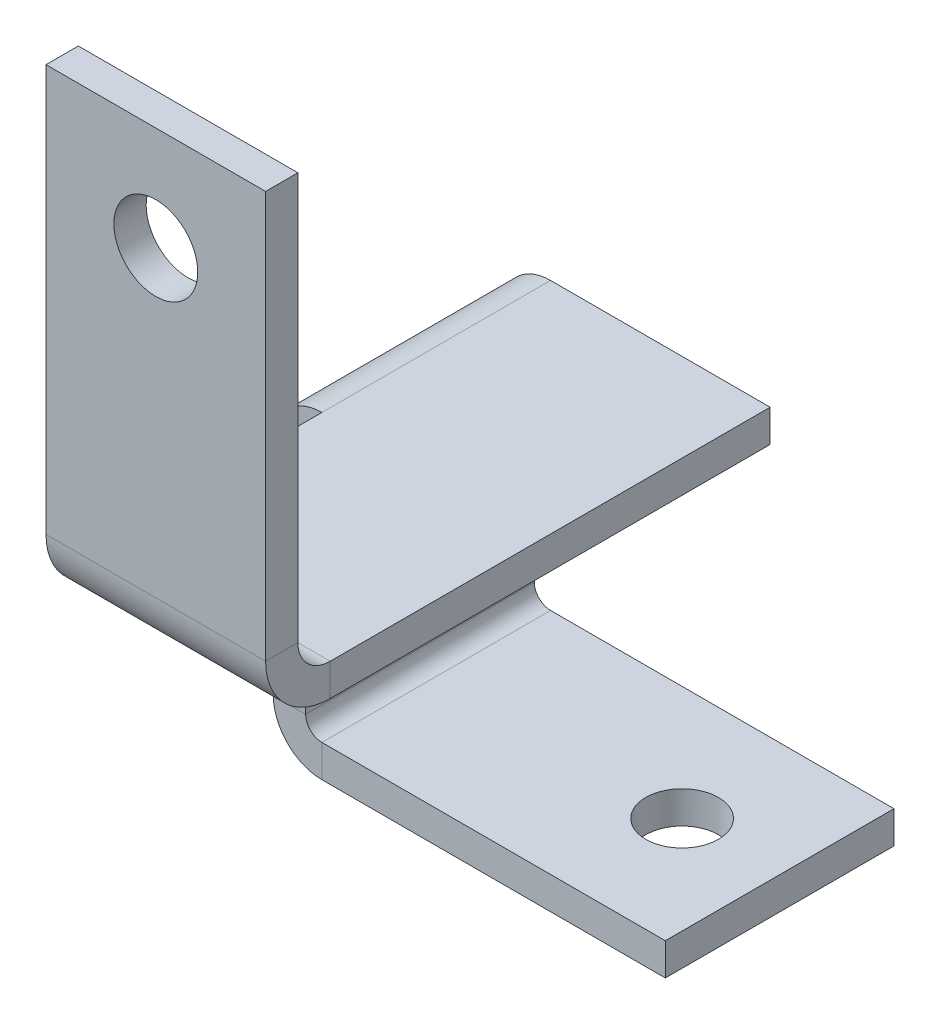
from build123d import *

# Parameters (mm, degrees)
SKETCH1_W                    = 21.59
SKETCH1_H                    = 43.18
SKETCH1_R                    = 4.124999878
BOSS_EXTRUDE1_DEPTH          = 3.175
EDGE_FLANGE1_STRIP_W         = 19.05
EDGE_FLANGE1_STRIP_H         = 3.175
EDGE_FLANGE1_STRIP_CUT_DEPTH = 21.59
EDGE_FLANGE1_DEPTH           = 21.59
EDGE_FLANGE2_DEPTH           = 22.48154
EDGE_FLANGE2_START           = 3.175
EDGE_FLANGE2_FLAT_DEPTH      = 3.175
EDGE_FLANGE3_STRIP_W         = 15.900000204
EDGE_FLANGE3_STRIP_H         = 3.175
EDGE_FLANGE3_STRIP_CUT_DEPTH = 22.48154
EDGE_FLANGE3_DEPTH           = 22.48154
CUT_EXTRUDE2_REACH           = 96.019
SKETCH11_R                   = 3.57124


# Sheet-metal steps are written as plain solids
with BuildPart() as part:
    # Sketch1 → Boss-Extrude1 (new body)
    with BuildSketch(Plane.XY):
        with Locations((10.795, 0.048317484)):
            Rectangle(SKETCH1_W, SKETCH1_H)
        with Locations(Location((10.795, 11.418627484, 0), (0, 0, 180))):
            Circle(SKETCH1_R, mode=Mode.SUBTRACT)
    extrude(amount=BOSS_EXTRUDE1_DEPTH)

    # Edge-Flange1 strip (across the edge) → Edge-Flange1 strip cut (cut)
    with BuildSketch(Plane(origin=(21.59, -21.541682516, 0), x_dir=(0, 1, 0), z_dir=(-1, 0, 0))):
        with Locations((-6.35, -1.5875)):
            Rectangle(EDGE_FLANGE1_STRIP_W, EDGE_FLANGE1_STRIP_H)
    extrude(amount=EDGE_FLANGE1_STRIP_CUT_DEPTH, mode=Mode.SUBTRACT)

    # Edge-Flange1 section (across the edge) → Edge-Flange1 (add)
    with BuildSketch(Plane(origin=(21.59, -21.541682516, 0), x_dir=(0, 1, 0), z_dir=(-1, 0, 0))):
        with BuildLine():
            Line((-3.175, 3.175), (-3.175, 46.43374))
            Line((-3.175, 46.43374), (0, 46.43374))
            Line((0, 46.43374), (0, 3.175))
            ThreePointArc((0, 3.175), (0.92993597, 0.92993597), (3.175, 0))
            Line((3.175, 0), (3.175, -3.175))
            ThreePointArc((3.175, -3.175), (-1.315128061, -1.315128061), (-3.175, 3.175))
        make_face()
    extrude(amount=EDGE_FLANGE1_DEPTH)

    # Edge-Flange2 bend section (across the edge) → Edge-Flange2 (add)
    with BuildSketch(Plane(origin=(-1.600000102, -24.716682516, -23.9522), x_dir=(1, 0, 0), z_dir=(0, 0, -1))):
        with BuildLine():
            Line((-3.175, 1.600000102), (0, 1.600000102))
            ThreePointArc((0, 1.600000102), (0.46862918, 0.46862918), (1.600000102, 0))
            Line((1.600000102, 0), (1.600000102, -3.175))
            ThreePointArc((1.600000102, -3.175), (-1.77643485, -1.77643485), (-3.175, 1.600000102))
        make_face()
    extrude(amount=EDGE_FLANGE2_DEPTH)

    # Edge-Flange2 profile (on flange) → Edge-Flange2 flat (add)
    with BuildSketch(Plane(origin=(-1.600000102, -24.716682516, 0), x_dir=(0, 0, -1), z_dir=(-1, 0, 0)).offset(EDGE_FLANGE2_START)):
        Polygon((23.9522, 28.10002), (23.9522, 19.3675), (23.9522, 1.600000102), (46.43374, 1.600000102), (46.43374, 28.10002), align=None)
    extrude(amount=-EDGE_FLANGE2_FLAT_DEPTH)

    # Edge-Flange3 strip (across the edge) → Edge-Flange3 strip cut (cut)
    with BuildSketch(Plane(origin=(-1.600000102, -52.816702516, -23.9522), x_dir=(0, 1, 0), z_dir=(0, 0, -1))):
        with Locations((-3.175, -1.5875)):
            Rectangle(EDGE_FLANGE3_STRIP_W, EDGE_FLANGE3_STRIP_H)
    extrude(amount=EDGE_FLANGE3_STRIP_CUT_DEPTH, mode=Mode.SUBTRACT)

    # Edge-Flange3 section (across the edge) → Edge-Flange3 (add)
    with BuildSketch(Plane(origin=(-1.600000102, -52.816702516, -23.9522), x_dir=(0, 1, 0), z_dir=(0, 0, -1))):
        with BuildLine():
            Line((0, 1.600000102), (0, 35.364220102))
            Line((0, 35.364220102), (3.175, 35.364220102))
            Line((3.175, 35.364220102), (3.175, 1.600000102))
            ThreePointArc((3.175, 1.600000102), (3.64362918, 0.46862918), (4.775000102, 0))
            Line((4.775000102, 0), (4.775000102, -3.175))
            ThreePointArc((4.775000102, -3.175), (1.39856515, -1.77643485), (0, 1.600000102))
        make_face()
    extrude(amount=EDGE_FLANGE3_DEPTH)

    # Sketch11 → Cut-Extrude2 (cut, up to next)
    with BuildSketch(Plane.XZ.offset(52.816702516), mode=Mode.PRIVATE) as cut_extrude2_sk1:
        with Locations((24.17318, -35.19297)):
            Circle(SKETCH11_R)
    cut_extrude2_tool1 = extrude(cut_extrude2_sk1.sketch, amount=-CUT_EXTRUDE2_REACH, mode=Mode.PRIVATE) & part.part
    add(cut_extrude2_tool1.solids().sort_by_distance((24.17318, -52.816703, -35.19297))[0], mode=Mode.SUBTRACT)


solid = part.part
